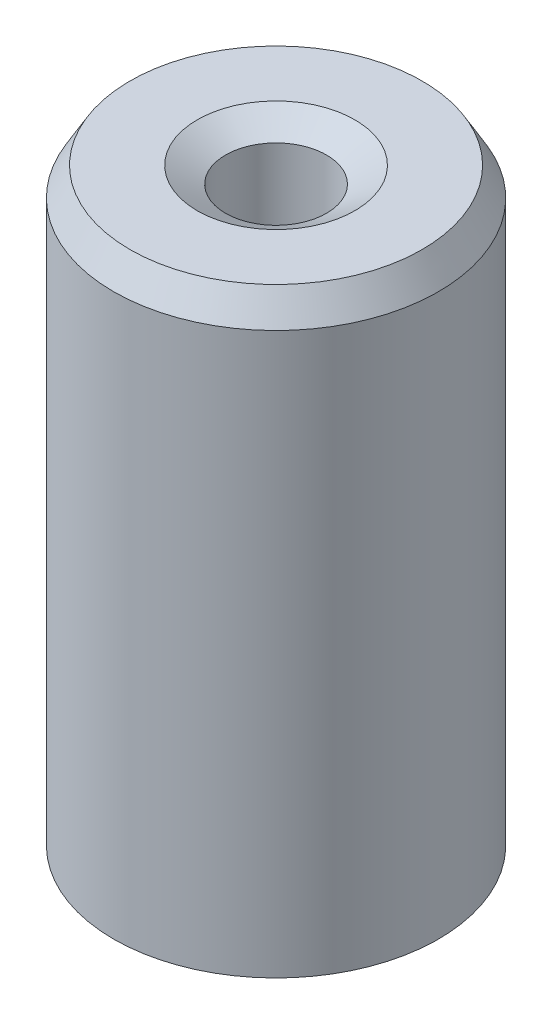
from build123d import *
from OCP.BRepFilletAPI import BRepFilletAPI_MakeChamfer

# Parameters (mm, degrees)
SKETCH1_R           = 7.5
BOSS_EXTRUDE1_DEPTH = 27.955865125
SKETCH2_R           = 2.331918405
CUT_EXTRUDE1_DEPTH  = 30.90034105
CHAMFER1_SIZE       = 1.307167953
CHAMFER1_SIZE2      = 0.75469377


with BuildPart() as part:
    # Sketch1 → Boss-Extrude1 (new body)
    with BuildSketch(Plane(origin=(0, 0, 0), x_dir=(1, 0, 0), z_dir=(0, 1, 0))):
        Circle(SKETCH1_R)
    extrude(amount=BOSS_EXTRUDE1_DEPTH)

    # Sketch2 → Cut-Extrude1 (cut, through all)
    with BuildSketch(Plane(origin=(0, 0, 0), x_dir=(1, 0, 0), z_dir=(0, 1, 0))):
        Circle(SKETCH2_R)
    extrude(amount=CUT_EXTRUDE1_DEPTH, mode=Mode.SUBTRACT)

    # Chamfer1: one chamfer whose edges measure the first distance from different faces: ONE call of the kernel's chamfer builder (chamfer() names one face for all edges)
    chamfer1_edges_1 = [part.edges().sort_by_distance(p)[0] for p in [
        (-2.331918405, 27.955865125, 0),
    ]]
    chamfer1_side_1 = [part.faces().sort_by_distance(p)[0] for p in [
        (-7.287867966, 27.955865125, 0),
    ]]
    chamfer1_edges_2 = [part.edges().sort_by_distance(p)[0] for p in [
        (-2.331918405, 0, 0),
    ]]
    chamfer1_side_2 = [part.faces().sort_by_distance(p)[0] for p in [
        (-2.331918405, 13.977932563, 0),
    ]]
    chamfer1_edges_3 = [part.edges().sort_by_distance(p)[0] for p in [
        (-7.5, 0, 0),
    ]]
    chamfer1_side_3 = [part.faces().sort_by_distance(p)[0] for p in [
        (-7.287867966, 0, 0),
    ]]
    chamfer1_edges_4 = [part.edges().sort_by_distance(p)[0] for p in [
        (-7.5, 27.955865125, 0),
    ]]
    chamfer1_side_4 = [part.faces().sort_by_distance(p)[0] for p in [
        (-7.5, 13.977932563, 0),
    ]]
    chamfer1 = BRepFilletAPI_MakeChamfer(part.part.solid().wrapped)
    for e in chamfer1_edges_1:
        chamfer1.Add(CHAMFER1_SIZE, CHAMFER1_SIZE2, e.wrapped, chamfer1_side_1[0].wrapped)  # the first distance lies on this face
    for e in chamfer1_edges_2:
        chamfer1.Add(CHAMFER1_SIZE, CHAMFER1_SIZE2, e.wrapped, chamfer1_side_2[0].wrapped)  # the first distance lies on this face
    for e in chamfer1_edges_3:
        chamfer1.Add(CHAMFER1_SIZE, CHAMFER1_SIZE2, e.wrapped, chamfer1_side_3[0].wrapped)  # the first distance lies on this face
    for e in chamfer1_edges_4:
        chamfer1.Add(CHAMFER1_SIZE, CHAMFER1_SIZE2, e.wrapped, chamfer1_side_4[0].wrapped)  # the first distance lies on this face
    add(Compound.cast(chamfer1.Shape()), mode=Mode.REPLACE)


solid = part.part
